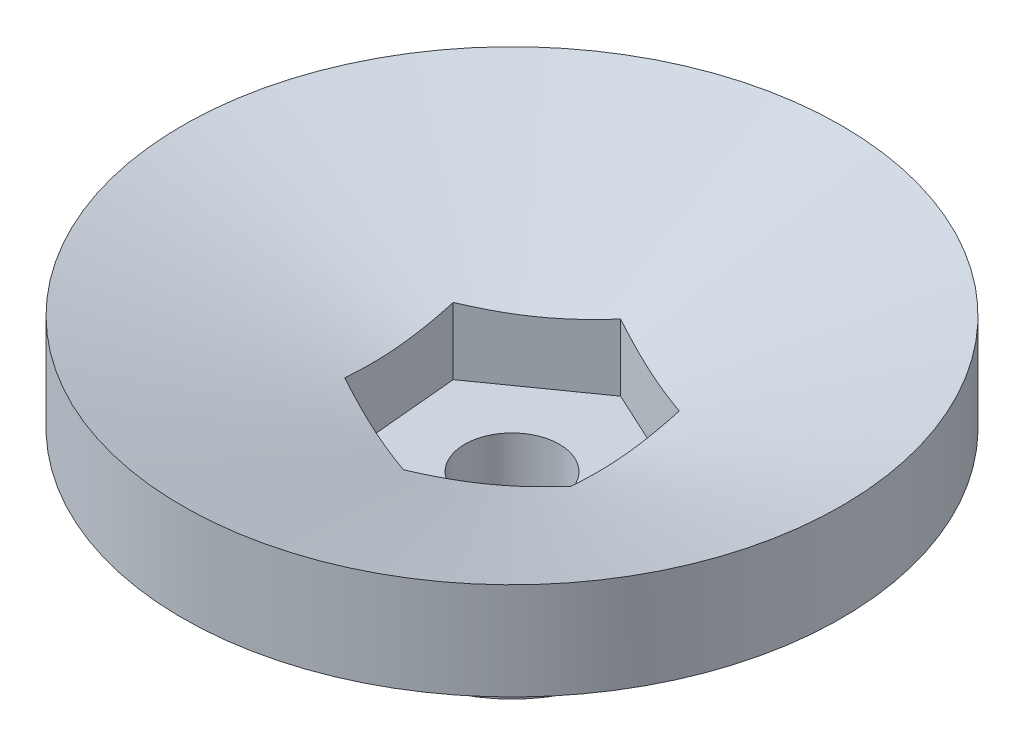
from build123d import *

# Parameters (mm, degrees)
CUT_EXTRUDE_1_DEPTH      = 45.054236589
CUT_EXTRUDE_1_DEPTH_BACK = 45.054236589
SKETCH_2_W               = 30
SKETCH_2_H               = 10
SKETCH_3_R               = 3
CUT_EXTRUDE_2_DEPTH      = 43.296024461
SKETCH_5_R               = 10
EXTRUDE_1_DEPTH          = 9
CUT_EXTRUDE_7_DEPTH      = 43.296024461
CUT_EXTRUDE_7_DEPTH_BACK = 43.296024461
SKETCH_6_R               = 4.1
FILLET_2_R               = 5
CUT_EXTRUDE_8_DEPTH      = 4
CUT_EXTRUDE_8_DEPTH_BACK = 12


with BuildPart() as part:
    # 草图1 → 旋转2 (revolve)
    with BuildSketch(Plane.XY, mode=Mode.PRIVATE) as revolve_2_sk:
        Polygon((0, 0), (0, 8.411697794), (28.531695489, 17.682207625), (28.531695489, 9.270509831), align=None)
    revolve(revolve_2_sk.sketch.rotate(Axis((0, 0, 0), (0, 1, 0)), 270), axis=Axis((0, 0, 0), (0, 1, 0)))

    # 草图2 → 切除-拉伸1 (cut, two sides: drawn at the far end of the back side and taken through both)
    with BuildSketch(Plane.XY.offset(-CUT_EXTRUDE_1_DEPTH_BACK)):
        Rectangle(SKETCH_2_W, SKETCH_2_H)
    extrude(amount=CUT_EXTRUDE_1_DEPTH + CUT_EXTRUDE_1_DEPTH_BACK, mode=Mode.SUBTRACT)

    # 草图3 → 切除-拉伸2 (cut, through all)
    with BuildSketch(Plane.XZ.offset(-5)):
        with Locations(Location((0, 0, 0), (0, 0, 270))):
            Circle(SKETCH_3_R)
    extrude(amount=-CUT_EXTRUDE_2_DEPTH, mode=Mode.SUBTRACT)

    # 草图5 → 凸台-拉伸1 (add)
    with BuildSketch(Plane.XZ.offset(-5)):
        with Locations(Location((0, 0, 0), (0, 0, 90))):
            Circle(SKETCH_5_R)
    extrude(amount=EXTRUDE_1_DEPTH)

    # 草图6 → 切除-拉伸7 (cut, two sides: drawn at the far end of the back side and taken through both)
    with BuildSketch(Plane(origin=(0, 5, 0), x_dir=(1, 0, 0), z_dir=(0, 1, 0)).offset(-CUT_EXTRUDE_7_DEPTH_BACK)):
        with Locations(Location((0, 0, 0), (0, 0, 270))):
            Circle(SKETCH_6_R)
    extrude(amount=CUT_EXTRUDE_7_DEPTH + CUT_EXTRUDE_7_DEPTH_BACK, mode=Mode.SUBTRACT)

    # 圆角2
    fillet_2_edges = [part.edges().sort_by_distance(p)[0] for p in [
        (0, 5, -10),
    ]]
    fillet(fillet_2_edges, radius=FILLET_2_R - 0.0001)  # a hair under: the kernel refuses the full size

    # 草图9 → 切除-拉伸8 (cut, two sides: drawn at the far end of the back side and taken through both)
    with BuildSketch(Plane(origin=(0, 10, 0), x_dir=(-1, 0, 0), z_dir=(0, -1, 0)).offset(-CUT_EXTRUDE_8_DEPTH_BACK)):
        Polygon((8.48568544, -5.999428524), (9.43850023, 4.349104898), (0.95281479, 10.348533422), (-8.48568544, 5.999428524), (-9.43850023, -4.349104898), (-0.95281479, -10.348533422), align=None)
    extrude(amount=CUT_EXTRUDE_8_DEPTH + CUT_EXTRUDE_8_DEPTH_BACK, mode=Mode.SUBTRACT)


solid = part.part
